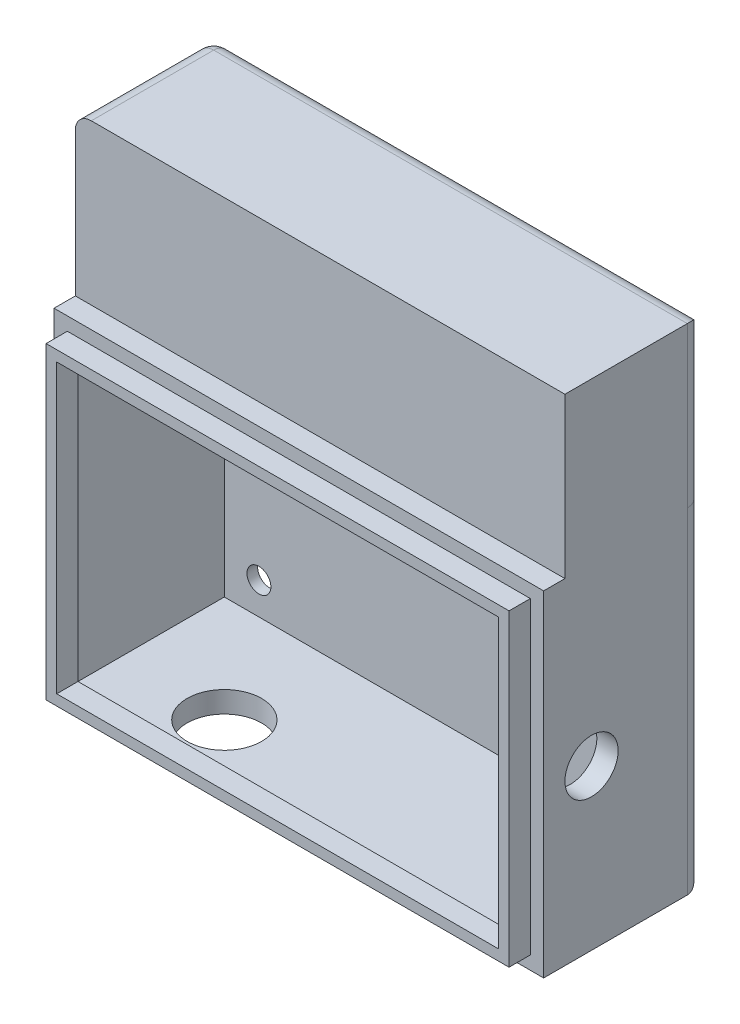
from build123d import *

# Parameters (mm, degrees)
SKETCH3_W           = 92
SKETCH3_H           = 63
SKETCH3_R           = 2.25
BOSS_EXTRUDE3_DEPTH = 30
SKETCH4_W           = 84
SKETCH4_H           = 55
CUT_EXTRUDE1_DEPTH  = 28
FILLET1_R           = 3
SKETCH5_W           = 87
SKETCH5_H           = 58
BOSS_EXTRUDE4_DEPTH = 4
SKETCH7_W           = 83
SKETCH7_H           = 54
CUT_EXTRUDE4_DEPTH  = 27
SKETCH9_R           = 7
CUT_EXTRUDE6_DEPTH  = 27
SKETCH11_R          = 5
CUT_EXTRUDE7_DEPTH  = 27
SKETCH12_R          = 2.25
CUT_EXTRUDE8_DEPTH  = 10
SKETCH13_W          = 92
SKETCH13_H          = 26
BOSS_EXTRUDE6_DEPTH = 30
SKETCH14_W          = 23
SKETCH14_H          = 24
CUT_EXTRUDE9_DEPTH  = 90
FILLET3_R           = 3
FILLET4_R           = 3


with BuildPart() as part:
    # Sketch3 → Boss-Extrude3 (new body)
    with BuildSketch(Plane.XY):
        with Locations((46, 31.5)):
            Rectangle(SKETCH3_W, SKETCH3_H)
        with Locations((82, 53)):
            Circle(SKETCH3_R, mode=Mode.SUBTRACT)
        with Locations((82, 10)):
            Circle(SKETCH3_R, mode=Mode.SUBTRACT)
        with Locations((10.5, 10)):
            Circle(SKETCH3_R, mode=Mode.SUBTRACT)
        with Locations((10.5, 53)):
            Circle(SKETCH3_R, mode=Mode.SUBTRACT)
    extrude(amount=BOSS_EXTRUDE3_DEPTH)

    # Sketch4 → Cut-Extrude1 (cut)
    with BuildSketch(Plane.XY.offset(30)):
        with Locations((46, 31.5)):
            Rectangle(SKETCH4_W, SKETCH4_H)
    extrude(amount=-CUT_EXTRUDE1_DEPTH, mode=Mode.SUBTRACT)

    # Fillet1
    fillet1_edges = [part.edges().sort_by_distance(p)[0] for p in [
        (92, 31.5, 0),
        (46, 0, 0),
        (0, 31.5, 0),
    ]]
    fillet(fillet1_edges, radius=FILLET1_R)

    # Sketch5 → Boss-Extrude4 (add)
    with BuildSketch(Plane.XY.offset(30)):
        with Locations((46, 31.5)):
            Rectangle(SKETCH5_W, SKETCH5_H)
    extrude(amount=BOSS_EXTRUDE4_DEPTH)

    # Sketch7 → Cut-Extrude4 (cut)
    with BuildSketch(Plane.XY.offset(34)):
        with Locations((46, 31.5)):
            Rectangle(SKETCH7_W, SKETCH7_H)
    extrude(amount=-CUT_EXTRUDE4_DEPTH, mode=Mode.SUBTRACT)

    # Sketch9 → Cut-Extrude6 (cut)
    with BuildSketch(Plane.XZ):
        with Locations(Location((24, 22, 0), (0, 0, 270))):
            Circle(SKETCH9_R)
    extrude(amount=-CUT_EXTRUDE6_DEPTH, mode=Mode.SUBTRACT)

    # Sketch11 → Cut-Extrude7 (cut)
    with BuildSketch(Plane(origin=(92, 0, 0), x_dir=(0, 0, -1), z_dir=(1, 0, 0))):
        with Locations((-21, 30)):
            Circle(SKETCH11_R)
    extrude(amount=-CUT_EXTRUDE7_DEPTH, mode=Mode.SUBTRACT)

    # Sketch12 → Cut-Extrude8 (cut)
    with BuildSketch(Plane.ZY):
        with Locations((16, 44)):
            Circle(SKETCH12_R)
    extrude(amount=-CUT_EXTRUDE8_DEPTH, mode=Mode.SUBTRACT)

    # Sketch13 → Boss-Extrude6 (add)
    with BuildSketch(Plane(origin=(0, 63, 0), x_dir=(1, 0, 0), z_dir=(0, 1, 0))):
        with Locations((46, -13)):
            Rectangle(SKETCH13_W, SKETCH13_H)
    extrude(amount=BOSS_EXTRUDE6_DEPTH)

    # Sketch14 → Cut-Extrude9 (cut)
    with BuildSketch(Plane.ZY):
        with Locations((13, 79)):
            Rectangle(SKETCH14_W, SKETCH14_H)
    extrude(amount=-CUT_EXTRUDE9_DEPTH, mode=Mode.SUBTRACT)

    # Fillet3
    fillet3_edges = [part.edges().sort_by_distance(p)[0] for p in [
        (46, 93, 0),
        (92, 78, 0),
    ]]
    fillet(fillet3_edges, radius=FILLET3_R)

    # Fillet4
    # the kernel refuses this fillet: 3 mm, written as the material it takes off along each edge
    with BuildSketch(Plane(origin=(0, 93, 33.5), x_dir=(0, -1, 0), z_dir=(0, 0, -1))) as fillet4_piece_1:
        with BuildLine():
            CenterArc((FILLET4_R, -FILLET4_R), FILLET4_R, 90, 90)
            Line((0, -FILLET4_R), (0, 0))
            Line((0, 0), (FILLET4_R, 0))
        make_face()
    extrude(amount=30.5, mode=Mode.SUBTRACT)
    with BuildSketch(Plane(origin=(0, 55.5, 0), x_dir=(0, 0, 1), z_dir=(0, 1, 0))) as fillet4_piece_2:
        with BuildLine():
            CenterArc((FILLET4_R, FILLET4_R), FILLET4_R, 180, 90)
            Line((0, FILLET4_R), (0, 0))
            Line((0, 0), (FILLET4_R, 0))
        make_face()
    extrude(amount=34.5, mode=Mode.SUBTRACT)
    with BuildSketch(Plane(origin=(0, 90, 3), x_dir=(0, 1, 0), z_dir=(0, 0, 1))) as fillet4_piece_3:
        with BuildLine():
            CenterArc((3 - FILLET4_R, -FILLET4_R), FILLET4_R, 0, 90)
            Line((3, -FILLET4_R), (3, 0))
            Line((3, 0), (3 - FILLET4_R, 0))
        make_face()
    revolve(axis=Axis((0, 90, 3), (-1, 0, 0)), revolution_arc=90, mode=Mode.SUBTRACT)


solid = part.part
